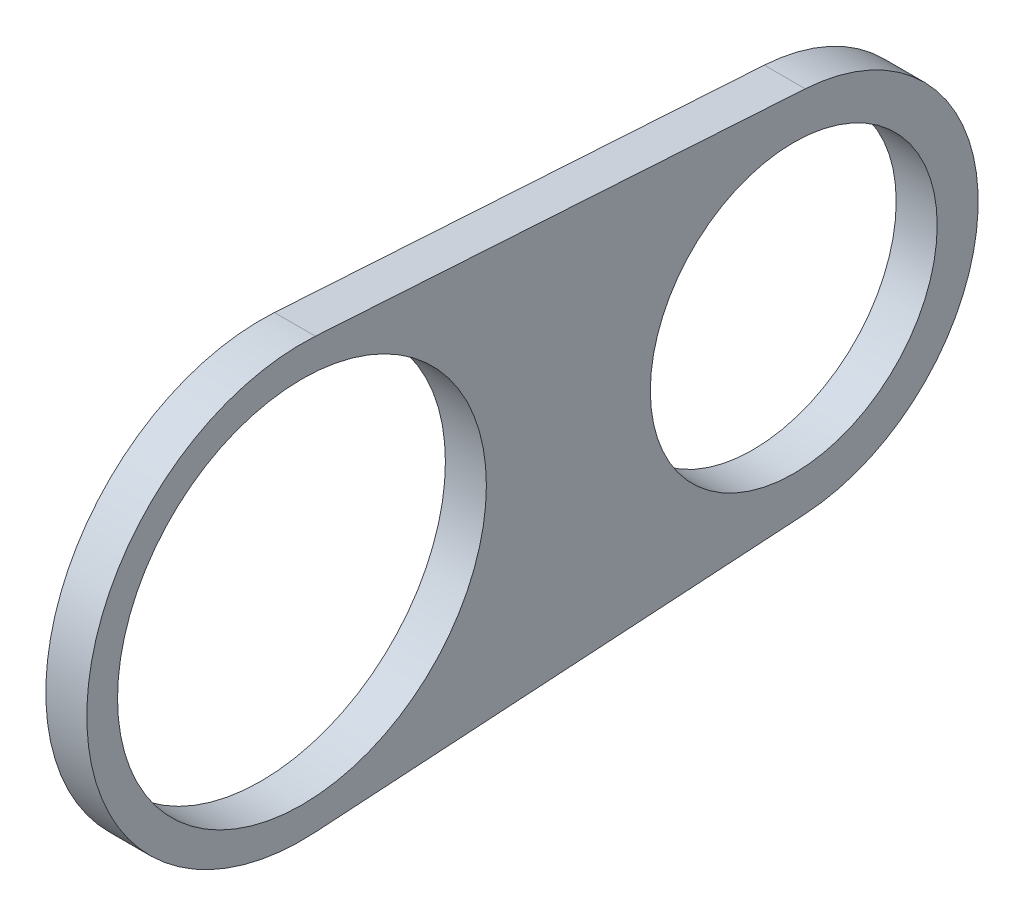
from build123d import *

# Parameters (mm, degrees)
SKETCH1_R           = 14.2875
SKETCH1_R_2         = 11.1125
BOSS_EXTRUDE1_DEPTH = 3.175


with BuildPart() as part:
    # Sketch1 → Boss-Extrude1 (new body)
    with BuildSketch(Plane(origin=(0, 0, 0), x_dir=(0, 0, -1), z_dir=(1, 0, 0))):
        with BuildLine():
            Line((-18.008203125, 16.636161992), (19.94296875, 14.259567422))
            ThreePointArc((19.94296875, 14.259567422), (33.3375, 0), (19.94296875, -14.259567422))
            Line((19.94296875, -14.259567422), (-18.008203125, -16.636161992))
            ThreePointArc((-18.008203125, -16.636161992), (-35.71875, 0), (-18.008203125, 16.636161992))
        make_face()
        with Locations((-19.05, 0)):
            Circle(SKETCH1_R, mode=Mode.SUBTRACT)
        with Locations((19.05, 0)):
            Circle(SKETCH1_R_2, mode=Mode.SUBTRACT)
    extrude(amount=BOSS_EXTRUDE1_DEPTH)


solid = part.part
